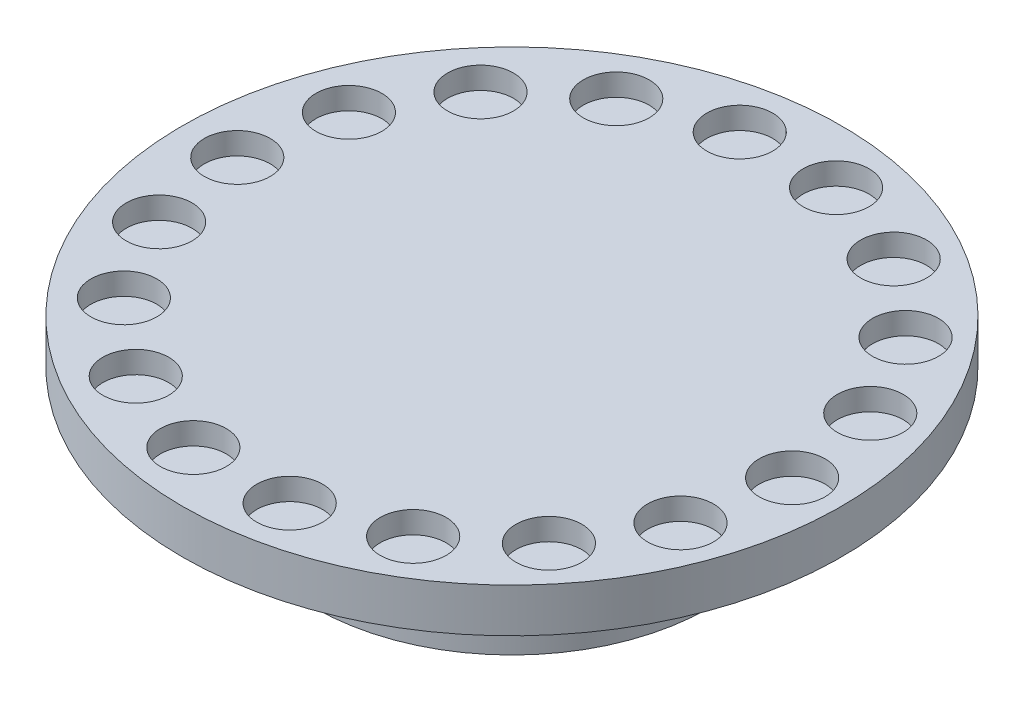
from build123d import *

# Parameters (mm, degrees)
ESQUISSE1_R                      = 90
BOSS_EXTRU_1_DEPTH               = 50
ESQUISSE2_R                      = 70
ENL_V_MAT_EXTRU_1_DEPTH          = 10
ESQUISSE3_R                      = 150
BOSS_EXTRU_2_DEPTH               = 20
ESQUISSE4_R                      = 15
ENL_V_MAT_EXTRU_2_DEPTH          = 10
R_P_TITION_START                 = 60
R_P_TITION_CIRCULAIRE1_OUTLINE_R = 15
R_P_TITION_CIRCULAIRE1_DEPTH     = 10


# Read off the part's stored shape, not the designer's step: Répétition circulaire1
with BuildPart() as part:
    # Esquisse1 → Boss.-Extru.1 (new body)
    with BuildSketch(Plane(origin=(0, 0, 0), x_dir=(1, 0, 0), z_dir=(0, 1, 0))):
        with Locations(Location((0, 0, 0), (0, 0, 270))):
            Circle(ESQUISSE1_R)
    extrude(amount=BOSS_EXTRU_1_DEPTH)

    # Esquisse2 → Enlèv. mat.-Extru.1 (cut)
    with BuildSketch(Plane(origin=(0, 0, 0), x_dir=(-1, 0, 0), z_dir=(0, -1, 0))):
        with Locations(Location((0, 0, 0), (0, 0, 90))):
            Circle(ESQUISSE2_R)
    extrude(amount=-ENL_V_MAT_EXTRU_1_DEPTH, mode=Mode.SUBTRACT)

    # Esquisse3 → Boss.-Extru.2 (add)
    with BuildSketch(Plane(origin=(0, 50, 0), x_dir=(1, 0, 0), z_dir=(0, 1, 0))):
        with Locations(Location((0, 0, 0), (0, 0, 270))):
            Circle(ESQUISSE3_R)
    extrude(amount=BOSS_EXTRU_2_DEPTH)

    # Esquisse4 → Enlèv. mat.-Extru.2 (cut)
    with BuildSketch(Plane(origin=(0, 70, 0), x_dir=(1, 0, 0), z_dir=(0, 1, 0))):
        with Locations(Location((-125, 0, 0), (0, 0, 270))):
            Circle(ESQUISSE4_R)
    extrude(amount=-ENL_V_MAT_EXTRU_2_DEPTH, mode=Mode.SUBTRACT)

    # Répétition circulaire1 outline → Répétition circulaire1 (cut)
    with BuildSketch(Plane(origin=(0, 0, 0), x_dir=(1, 0, 0), z_dir=(0, 1, 0)).offset(R_P_TITION_START)):
        with Locations((-117.385431917, -43.184361531)):
            Circle(R_P_TITION_CIRCULAIRE1_OUTLINE_R)
        with Locations((-117.385431917, 43.184361531)):
            Circle(R_P_TITION_CIRCULAIRE1_OUTLINE_R)
        with Locations((-95.460156959, 81.160051728)):
            Circle(R_P_TITION_CIRCULAIRE1_OUTLINE_R)
        with Locations((-61.868686869, 109.346641892)):
            Circle(R_P_TITION_CIRCULAIRE1_OUTLINE_R)
        with Locations((-20.662648695, 124.344413259)):
            Circle(R_P_TITION_CIRCULAIRE1_OUTLINE_R)
        with Locations((23.187901221, 124.344413259)):
            Circle(R_P_TITION_CIRCULAIRE1_OUTLINE_R)
        with Locations((64.393939394, 109.346641892)):
            Circle(R_P_TITION_CIRCULAIRE1_OUTLINE_R)
        with Locations((97.985409485, 81.160051728)):
            Circle(R_P_TITION_CIRCULAIRE1_OUTLINE_R)
        with Locations((119.910684443, 43.184361531)):
            Circle(R_P_TITION_CIRCULAIRE1_OUTLINE_R)
        with Locations((127.525252525, 0)):
            Circle(R_P_TITION_CIRCULAIRE1_OUTLINE_R)
        with Locations((119.910684443, -43.184361531)):
            Circle(R_P_TITION_CIRCULAIRE1_OUTLINE_R)
        with Locations((97.985409485, -81.160051728)):
            Circle(R_P_TITION_CIRCULAIRE1_OUTLINE_R)
        with Locations((64.393939394, -109.346641892)):
            Circle(R_P_TITION_CIRCULAIRE1_OUTLINE_R)
        with Locations((23.187901221, -124.344413259)):
            Circle(R_P_TITION_CIRCULAIRE1_OUTLINE_R)
        with Locations((-20.662648695, -124.344413259)):
            Circle(R_P_TITION_CIRCULAIRE1_OUTLINE_R)
        with Locations((-61.868686869, -109.346641892)):
            Circle(R_P_TITION_CIRCULAIRE1_OUTLINE_R)
        with Locations((-95.460156959, -81.160051728)):
            Circle(R_P_TITION_CIRCULAIRE1_OUTLINE_R)
    extrude(amount=R_P_TITION_CIRCULAIRE1_DEPTH, mode=Mode.SUBTRACT)


solid = part.part
